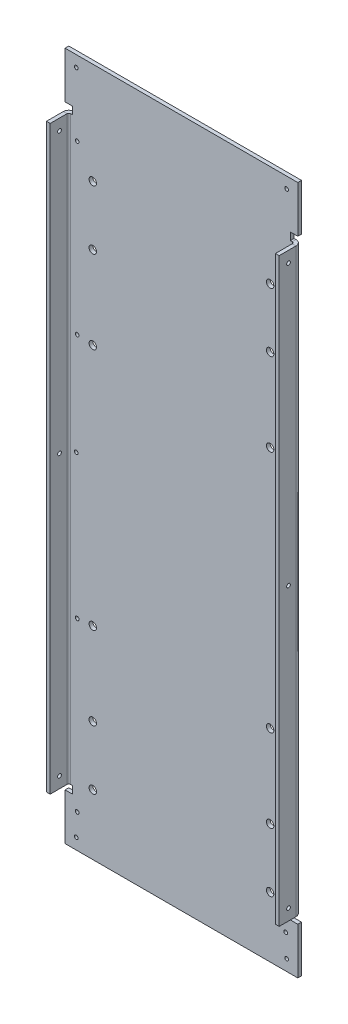
from build123d import *

# Parameters (mm, degrees)
SKETCH1_R                      = 2
SKETCH1_R_2                    = 1
BASE_FLANGE1_DEPTH             = 2
EDGE_FLANGE1_STRIP_W           = 9.9304
EDGE_FLANGE1_STRIP_H           = 2
EDGE_FLANGE1_STRIP_CUT_DEPTH   = 312
EDGE_FLANGE1_STRIP_2_W         = 9.9304
EDGE_FLANGE1_STRIP_2_H         = 2
EDGE_FLANGE1_STRIP_CUT_2_DEPTH = 312
EDGE_FLANGE1_DEPTH             = 312
EDGE_FLANGE1_BEND_DEPTH        = 312
SKETCH13_R                     = 1
CUT_EXTRUDE1_DEPTH             = 224.494966386


# Sheet-metal steps are written as plain solids
with BuildPart() as part:
    # Sketch1 → Base-Flange1 (new body)
    with BuildSketch(Plane(origin=(0, 0, 0), x_dir=(0, 1, 0), z_dir=(0, 0, 1))):
        Polygon((185, 62.5), (160, 62.5), (160, 58.5), (156, 58.5), (156, 62.5), (-156, 62.5), (-156, 58.5), (-160, 58.5), (-160, 62.5), (-185, 62.5), (-185, -62.5), (-160, -62.5), (-160, -58.5), (-156, -58.5), (-156, -62.5), (156, -62.5), (156, -58.5), (160, -58.5), (160, -62.5), (185, -62.5), align=None)
        with Locations(Location((-152.48, 47.625, 0), (0, 0, 270))):
            Circle(SKETCH1_R, mode=Mode.SUBTRACT)
        with Locations(Location((-120.73, 47.625, 0), (0, 0, 270))):
            Circle(SKETCH1_R, mode=Mode.SUBTRACT)
        with Locations(Location((-76.28, 47.625, 0), (0, 0, 270))):
            Circle(SKETCH1_R, mode=Mode.SUBTRACT)
        with Locations(Location((-152.48, -47.625, 0), (0, 0, 270))):
            Circle(SKETCH1_R, mode=Mode.SUBTRACT)
        with Locations(Location((-120.73, -47.625, 0), (0, 0, 270))):
            Circle(SKETCH1_R, mode=Mode.SUBTRACT)
        with Locations(Location((-76.28, -47.625, 0), (0, 0, 270))):
            Circle(SKETCH1_R, mode=Mode.SUBTRACT)
        with Locations(Location((54.28, 47.625, 0), (0, 0, 90))):
            Circle(SKETCH1_R, mode=Mode.SUBTRACT)
        with Locations(Location((98.73, 47.625, 0), (0, 0, 90))):
            Circle(SKETCH1_R, mode=Mode.SUBTRACT)
        with Locations(Location((130.48, 47.625, 0), (0, 0, 90))):
            Circle(SKETCH1_R, mode=Mode.SUBTRACT)
        with Locations(Location((130.48, -47.625, 0), (0, 0, 90))):
            Circle(SKETCH1_R, mode=Mode.SUBTRACT)
        with Locations(Location((98.73, -47.625, 0), (0, 0, 90))):
            Circle(SKETCH1_R, mode=Mode.SUBTRACT)
        with Locations(Location((54.28, -47.625, 0), (0, 0, 90))):
            Circle(SKETCH1_R, mode=Mode.SUBTRACT)
        with Locations(Location((-179, 56.5, 0), (0, 0, 270))):
            Circle(SKETCH1_R_2, mode=Mode.SUBTRACT)
        with Locations(Location((-179, -56.5, 0), (0, 0, 270))):
            Circle(SKETCH1_R_2, mode=Mode.SUBTRACT)
        with Locations(Location((179, -56.5, 0), (0, 0, 270))):
            Circle(SKETCH1_R_2, mode=Mode.SUBTRACT)
        with Locations(Location((179, 56.5, 0), (0, 0, 270))):
            Circle(SKETCH1_R_2, mode=Mode.SUBTRACT)
        with Locations(Location((0, 56.5, 0), (0, 0, 270))):
            Circle(SKETCH1_R_2, mode=Mode.SUBTRACT)
        with Locations(Location((0, -56.5, 0), (0, 0, 270))):
            Circle(SKETCH1_R_2, mode=Mode.SUBTRACT)
        with Locations(Location((-167, 56, 0), (0, 0, 270))):
            Circle(SKETCH1_R_2, mode=Mode.SUBTRACT)
        with Locations(Location((-77, 56, 0), (0, 0, 270))):
            Circle(SKETCH1_R_2, mode=Mode.SUBTRACT)
        with Locations(Location((-167, -56, 0), (0, 0, 270))):
            Circle(SKETCH1_R_2, mode=Mode.SUBTRACT)
        with Locations(Location((-77, -56, 0), (0, 0, 270))):
            Circle(SKETCH1_R_2, mode=Mode.SUBTRACT)
        with Locations(Location((55, -56, 0), (0, 0, 90))):
            Circle(SKETCH1_R_2, mode=Mode.SUBTRACT)
        with Locations(Location((145, -56, 0), (0, 0, 90))):
            Circle(SKETCH1_R_2, mode=Mode.SUBTRACT)
        with Locations(Location((55, 56, 0), (0, 0, 90))):
            Circle(SKETCH1_R_2, mode=Mode.SUBTRACT)
        with Locations(Location((145, 56, 0), (0, 0, 90))):
            Circle(SKETCH1_R_2, mode=Mode.SUBTRACT)
    extrude(amount=-BASE_FLANGE1_DEPTH)

    # Edge-Flange1 strip (across the edge) → Edge-Flange1 strip cut (cut)
    with BuildSketch(Plane(origin=(-62.5, 156, 0), x_dir=(1, 0, 0), z_dir=(0, -1, 0))):
        with Locations((-2, -1)):
            Rectangle(EDGE_FLANGE1_STRIP_W, EDGE_FLANGE1_STRIP_H)
    extrude(amount=EDGE_FLANGE1_STRIP_CUT_DEPTH, mode=Mode.SUBTRACT)

    # Edge-Flange1 strip 2 (across the edge) → Edge-Flange1 strip cut 2 (cut)
    with BuildSketch(Plane(origin=(62.5, -156, 0), x_dir=(-1, 0, 0), z_dir=(0, 1, 0))):
        with Locations((-2, -1)):
            Rectangle(EDGE_FLANGE1_STRIP_2_W, EDGE_FLANGE1_STRIP_2_H)
    extrude(amount=EDGE_FLANGE1_STRIP_CUT_2_DEPTH, mode=Mode.SUBTRACT)

    # Edge-Flange1 section (across the edge) → Edge-Flange1 (add)
    with BuildSketch(Plane(origin=(-62.5, 156, 0), x_dir=(1, 0, 0), z_dir=(0, -1, 0))):
        with BuildLine():
            Line((0, 0.9652), (0, 10))
            Line((0, 10), (2, 10))
            Line((2, 10), (2, 0.9652))
            ThreePointArc((2, 0.9652), (2.282700535, 0.282700535), (2.9652, 0))
            Line((2.9652, 0), (2.9652, -2))
            ThreePointArc((2.9652, -2), (0.868486972, -1.131513028), (0, 0.9652))
        make_face()
    extrude(amount=EDGE_FLANGE1_DEPTH)

    # Edge-Flange1 section 2 (across the edge) → Edge-Flange1 bend (add)
    with BuildSketch(Plane(origin=(62.5, -156, 0), x_dir=(-1, 0, 0), z_dir=(0, 1, 0))):
        with BuildLine():
            Line((0, 0.9652), (0, 10))
            Line((0, 10), (2, 10))
            Line((2, 10), (2, 0.9652))
            ThreePointArc((2, 0.9652), (2.282700535, 0.282700535), (2.9652, 0))
            Line((2.9652, 0), (2.9652, -2))
            ThreePointArc((2.9652, -2), (0.868486972, -1.131513028), (0, 0.9652))
        make_face()
    extrude(amount=EDGE_FLANGE1_BEND_DEPTH)

    # Sketch13 → Cut-Extrude1 (cut, through all)
    with BuildSketch(Plane.YZ.offset(62.5)):
        with Locations(Location((0, 5, 0), (0, 0, 270))):
            Circle(SKETCH13_R)
        with Locations(Location((150, 5, 0), (0, 0, 270))):
            Circle(SKETCH13_R)
        with Locations(Location((-150, 5, 0), (0, 0, 270))):
            Circle(SKETCH13_R)
    extrude(amount=-CUT_EXTRUDE1_DEPTH, mode=Mode.SUBTRACT)


solid = part.part
